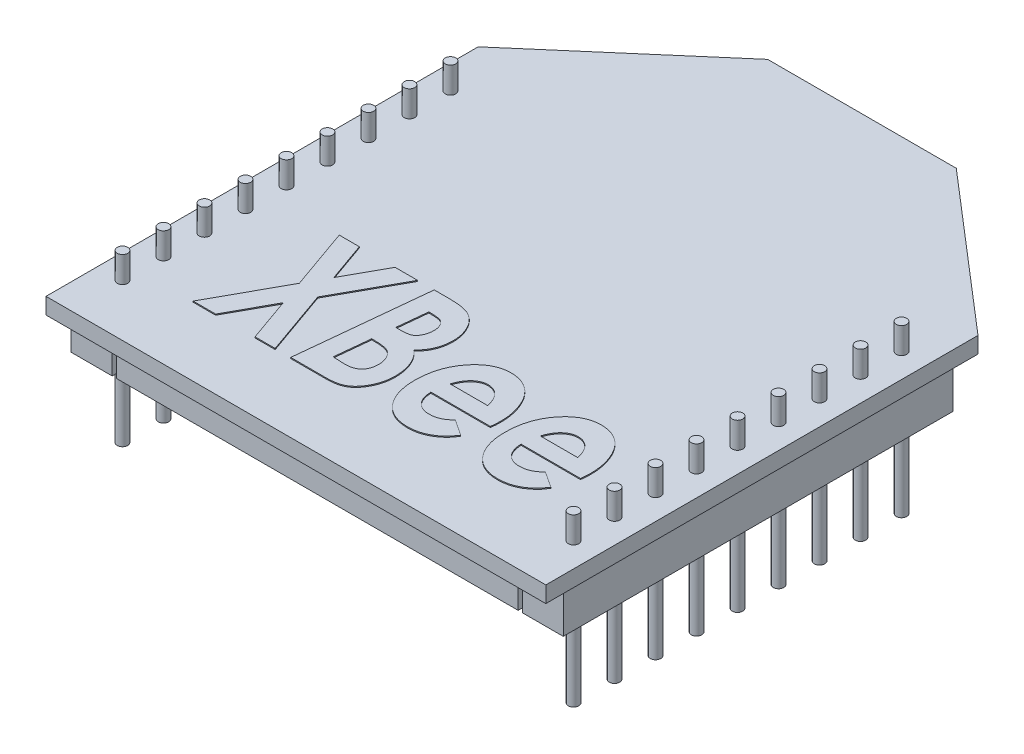
from build123d import *

# Parameters (mm, degrees)
BOSS_EXTRUDE2_DEPTH         = 0.79
SKETCH3_W                   = 2
SKETCH3_H                   = 19
SKETCH3_W_2                 = 19.6
BOSS_EXTRUDE3_DEPTH         = 2
BOSS_EXTRUDE4_DEPTH         = 1.27
BOSS_EXTRUDE4_DEPTH_BACK    = 6.85
SKETCH4_R                   = 0.255
BOSS_EXTRUDE4_2_DEPTH       = 1.27
BOSS_EXTRUDE4_2_DEPTH_BACK  = 6.85
BOSS_EXTRUDE4_3_DEPTH       = 1.27
BOSS_EXTRUDE4_3_DEPTH_BACK  = 6.85
BOSS_EXTRUDE4_4_DEPTH       = 1.27
BOSS_EXTRUDE4_4_DEPTH_BACK  = 6.85
BOSS_EXTRUDE4_5_DEPTH       = 1.27
BOSS_EXTRUDE4_5_DEPTH_BACK  = 6.85
BOSS_EXTRUDE4_6_DEPTH       = 1.27
BOSS_EXTRUDE4_6_DEPTH_BACK  = 6.85
BOSS_EXTRUDE4_7_DEPTH       = 1.27
BOSS_EXTRUDE4_7_DEPTH_BACK  = 6.85
BOSS_EXTRUDE4_8_DEPTH       = 1.27
BOSS_EXTRUDE4_8_DEPTH_BACK  = 6.85
BOSS_EXTRUDE4_9_DEPTH       = 1.27
BOSS_EXTRUDE4_9_DEPTH_BACK  = 6.85
BOSS_EXTRUDE4_10_DEPTH      = 1.27
BOSS_EXTRUDE4_10_DEPTH_BACK = 6.85
BOSS_EXTRUDE4_11_DEPTH      = 1.27
BOSS_EXTRUDE4_11_DEPTH_BACK = 6.85
BOSS_EXTRUDE4_12_DEPTH      = 1.27
BOSS_EXTRUDE4_12_DEPTH_BACK = 6.85
BOSS_EXTRUDE4_13_DEPTH      = 1.27
BOSS_EXTRUDE4_13_DEPTH_BACK = 6.85
BOSS_EXTRUDE4_14_DEPTH      = 1.27
BOSS_EXTRUDE4_14_DEPTH_BACK = 6.85
BOSS_EXTRUDE4_15_DEPTH      = 1.27
BOSS_EXTRUDE4_15_DEPTH_BACK = 6.85
BOSS_EXTRUDE4_16_DEPTH      = 1.27
BOSS_EXTRUDE4_16_DEPTH_BACK = 6.85
BOSS_EXTRUDE4_17_DEPTH      = 1.27
BOSS_EXTRUDE4_17_DEPTH_BACK = 6.85
BOSS_EXTRUDE4_18_DEPTH      = 1.27
BOSS_EXTRUDE4_18_DEPTH_BACK = 6.85
BOSS_EXTRUDE8_DEPTH         = 0.05
BOSS_EXTRUDE8_2_DEPTH       = 0.05
BOSS_EXTRUDE8_3_DEPTH       = 0.05
BOSS_EXTRUDE8_4_DEPTH       = 0.05


with BuildPart() as part:
    # Sketch1 → Boss-Extrude2 (new body)
    with BuildSketch(Plane(origin=(0, 0, 0), x_dir=(1, 0, 0), z_dir=(0, 1, 0))):
        Polygon((0, 0), (0, 21.08), (7.59, 27.61), (16.79, 27.61), (24.38, 21.08), (24.38, 0), align=None)
    extrude(amount=BOSS_EXTRUDE2_DEPTH)

    # Sketch3 → Boss-Extrude3 (add)
    with BuildSketch(Plane.XZ):
        with Locations((23.19, -10.54)):
            Rectangle(SKETCH3_W, SKETCH3_H)
        with Locations((1.19, -10.54)):
            Rectangle(SKETCH3_W, SKETCH3_H)
        with Locations((12.19, -10.54)):
            Rectangle(SKETCH3_W_2, SKETCH3_H)
    extrude(amount=BOSS_EXTRUDE3_DEPTH)


with BuildPart() as body_2:
    # Sketch4 → Boss-Extrude4 (new, two sides: drawn at the far end of the back side and taken through both)
    with BuildSketch(Plane(origin=(0, 0.79, 0), x_dir=(1, 0, 0), z_dir=(0, 1, 0)).offset(-BOSS_EXTRUDE4_DEPTH_BACK)):
        with Locations((1.19, 10.54)):
            Circle(SKETCH4_R)
    extrude(amount=BOSS_EXTRUDE4_DEPTH + BOSS_EXTRUDE4_DEPTH_BACK)


with BuildPart() as body_3:
    # Sketch4 → Boss-Extrude4 2 (new, two sides: drawn at the far end of the back side and taken through both)
    with BuildSketch(Plane(origin=(0, 0.79, 0), x_dir=(1, 0, 0), z_dir=(0, 1, 0)).offset(-BOSS_EXTRUDE4_2_DEPTH_BACK)):
        with Locations((1.19, 12.54)):
            Circle(SKETCH4_R)
    extrude(amount=BOSS_EXTRUDE4_2_DEPTH + BOSS_EXTRUDE4_2_DEPTH_BACK)


with BuildPart() as body_4:
    # Sketch4 → Boss-Extrude4 3 (new, two sides: drawn at the far end of the back side and taken through both)
    with BuildSketch(Plane(origin=(0, 0.79, 0), x_dir=(1, 0, 0), z_dir=(0, 1, 0)).offset(-BOSS_EXTRUDE4_3_DEPTH_BACK)):
        with Locations((1.19, 14.54)):
            Circle(SKETCH4_R)
    extrude(amount=BOSS_EXTRUDE4_3_DEPTH + BOSS_EXTRUDE4_3_DEPTH_BACK)


with BuildPart() as body_5:
    # Sketch4 → Boss-Extrude4 4 (new, two sides: drawn at the far end of the back side and taken through both)
    with BuildSketch(Plane(origin=(0, 0.79, 0), x_dir=(1, 0, 0), z_dir=(0, 1, 0)).offset(-BOSS_EXTRUDE4_4_DEPTH_BACK)):
        with Locations((1.19, 16.54)):
            Circle(SKETCH4_R)
    extrude(amount=BOSS_EXTRUDE4_4_DEPTH + BOSS_EXTRUDE4_4_DEPTH_BACK)


with BuildPart() as body_6:
    # Sketch4 → Boss-Extrude4 5 (new, two sides: drawn at the far end of the back side and taken through both)
    with BuildSketch(Plane(origin=(0, 0.79, 0), x_dir=(1, 0, 0), z_dir=(0, 1, 0)).offset(-BOSS_EXTRUDE4_5_DEPTH_BACK)):
        with Locations((1.19, 18.54)):
            Circle(SKETCH4_R)
    extrude(amount=BOSS_EXTRUDE4_5_DEPTH + BOSS_EXTRUDE4_5_DEPTH_BACK)


with BuildPart() as body_7:
    # Sketch4 → Boss-Extrude4 6 (new, two sides: drawn at the far end of the back side and taken through both)
    with BuildSketch(Plane(origin=(0, 0.79, 0), x_dir=(1, 0, 0), z_dir=(0, 1, 0)).offset(-BOSS_EXTRUDE4_6_DEPTH_BACK)):
        with Locations((1.19, 8.54)):
            Circle(SKETCH4_R)
    extrude(amount=BOSS_EXTRUDE4_6_DEPTH + BOSS_EXTRUDE4_6_DEPTH_BACK)


with BuildPart() as body_8:
    # Sketch4 → Boss-Extrude4 7 (new, two sides: drawn at the far end of the back side and taken through both)
    with BuildSketch(Plane(origin=(0, 0.79, 0), x_dir=(1, 0, 0), z_dir=(0, 1, 0)).offset(-BOSS_EXTRUDE4_7_DEPTH_BACK)):
        with Locations((1.19, 6.54)):
            Circle(SKETCH4_R)
    extrude(amount=BOSS_EXTRUDE4_7_DEPTH + BOSS_EXTRUDE4_7_DEPTH_BACK)


with BuildPart() as body_9:
    # Sketch4 → Boss-Extrude4 8 (new, two sides: drawn at the far end of the back side and taken through both)
    with BuildSketch(Plane(origin=(0, 0.79, 0), x_dir=(1, 0, 0), z_dir=(0, 1, 0)).offset(-BOSS_EXTRUDE4_8_DEPTH_BACK)):
        with Locations((1.19, 4.54)):
            Circle(SKETCH4_R)
    extrude(amount=BOSS_EXTRUDE4_8_DEPTH + BOSS_EXTRUDE4_8_DEPTH_BACK)


with BuildPart() as body_10:
    # Sketch4 → Boss-Extrude4 9 (new, two sides: drawn at the far end of the back side and taken through both)
    with BuildSketch(Plane(origin=(0, 0.79, 0), x_dir=(1, 0, 0), z_dir=(0, 1, 0)).offset(-BOSS_EXTRUDE4_9_DEPTH_BACK)):
        with Locations((1.19, 2.54)):
            Circle(SKETCH4_R)
    extrude(amount=BOSS_EXTRUDE4_9_DEPTH + BOSS_EXTRUDE4_9_DEPTH_BACK)


with BuildPart() as body_11:
    # Sketch4 → Boss-Extrude4 10 (new, two sides: drawn at the far end of the back side and taken through both)
    with BuildSketch(Plane(origin=(0, 0.79, 0), x_dir=(1, 0, 0), z_dir=(0, 1, 0)).offset(-BOSS_EXTRUDE4_10_DEPTH_BACK)):
        with Locations((23.19, 2.54)):
            Circle(SKETCH4_R)
    extrude(amount=BOSS_EXTRUDE4_10_DEPTH + BOSS_EXTRUDE4_10_DEPTH_BACK)


with BuildPart() as body_12:
    # Sketch4 → Boss-Extrude4 11 (new, two sides: drawn at the far end of the back side and taken through both)
    with BuildSketch(Plane(origin=(0, 0.79, 0), x_dir=(1, 0, 0), z_dir=(0, 1, 0)).offset(-BOSS_EXTRUDE4_11_DEPTH_BACK)):
        with Locations((23.19, 4.54)):
            Circle(SKETCH4_R)
    extrude(amount=BOSS_EXTRUDE4_11_DEPTH + BOSS_EXTRUDE4_11_DEPTH_BACK)


with BuildPart() as body_13:
    # Sketch4 → Boss-Extrude4 12 (new, two sides: drawn at the far end of the back side and taken through both)
    with BuildSketch(Plane(origin=(0, 0.79, 0), x_dir=(1, 0, 0), z_dir=(0, 1, 0)).offset(-BOSS_EXTRUDE4_12_DEPTH_BACK)):
        with Locations((23.19, 6.54)):
            Circle(SKETCH4_R)
    extrude(amount=BOSS_EXTRUDE4_12_DEPTH + BOSS_EXTRUDE4_12_DEPTH_BACK)


with BuildPart() as body_14:
    # Sketch4 → Boss-Extrude4 13 (new, two sides: drawn at the far end of the back side and taken through both)
    with BuildSketch(Plane(origin=(0, 0.79, 0), x_dir=(1, 0, 0), z_dir=(0, 1, 0)).offset(-BOSS_EXTRUDE4_13_DEPTH_BACK)):
        with Locations((23.19, 8.54)):
            Circle(SKETCH4_R)
    extrude(amount=BOSS_EXTRUDE4_13_DEPTH + BOSS_EXTRUDE4_13_DEPTH_BACK)


with BuildPart() as body_15:
    # Sketch4 → Boss-Extrude4 14 (new, two sides: drawn at the far end of the back side and taken through both)
    with BuildSketch(Plane(origin=(0, 0.79, 0), x_dir=(1, 0, 0), z_dir=(0, 1, 0)).offset(-BOSS_EXTRUDE4_14_DEPTH_BACK)):
        with Locations((23.19, 18.54)):
            Circle(SKETCH4_R)
    extrude(amount=BOSS_EXTRUDE4_14_DEPTH + BOSS_EXTRUDE4_14_DEPTH_BACK)


with BuildPart() as body_16:
    # Sketch4 → Boss-Extrude4 15 (new, two sides: drawn at the far end of the back side and taken through both)
    with BuildSketch(Plane(origin=(0, 0.79, 0), x_dir=(1, 0, 0), z_dir=(0, 1, 0)).offset(-BOSS_EXTRUDE4_15_DEPTH_BACK)):
        with Locations((23.19, 16.54)):
            Circle(SKETCH4_R)
    extrude(amount=BOSS_EXTRUDE4_15_DEPTH + BOSS_EXTRUDE4_15_DEPTH_BACK)


with BuildPart() as body_17:
    # Sketch4 → Boss-Extrude4 16 (new, two sides: drawn at the far end of the back side and taken through both)
    with BuildSketch(Plane(origin=(0, 0.79, 0), x_dir=(1, 0, 0), z_dir=(0, 1, 0)).offset(-BOSS_EXTRUDE4_16_DEPTH_BACK)):
        with Locations((23.19, 14.54)):
            Circle(SKETCH4_R)
    extrude(amount=BOSS_EXTRUDE4_16_DEPTH + BOSS_EXTRUDE4_16_DEPTH_BACK)


with BuildPart() as body_18:
    # Sketch4 → Boss-Extrude4 17 (new, two sides: drawn at the far end of the back side and taken through both)
    with BuildSketch(Plane(origin=(0, 0.79, 0), x_dir=(1, 0, 0), z_dir=(0, 1, 0)).offset(-BOSS_EXTRUDE4_17_DEPTH_BACK)):
        with Locations((23.19, 12.54)):
            Circle(SKETCH4_R)
    extrude(amount=BOSS_EXTRUDE4_17_DEPTH + BOSS_EXTRUDE4_17_DEPTH_BACK)


with BuildPart() as body_19:
    # Sketch4 → Boss-Extrude4 18 (new, two sides: drawn at the far end of the back side and taken through both)
    with BuildSketch(Plane(origin=(0, 0.79, 0), x_dir=(1, 0, 0), z_dir=(0, 1, 0)).offset(-BOSS_EXTRUDE4_18_DEPTH_BACK)):
        with Locations((23.19, 10.54)):
            Circle(SKETCH4_R)
    extrude(amount=BOSS_EXTRUDE4_18_DEPTH + BOSS_EXTRUDE4_18_DEPTH_BACK)


with BuildPart() as body_20:
    # Sketch6 → Boss-Extrude8 (new body)
    with BuildSketch(Plane(origin=(0, 0.79, 0), x_dir=(1, 0, 0), z_dir=(0, 1, 0))):
        Polygon((4.614192647, 9.688771644), (5.596203865, 9.688771644), (6.276742727, 7.764182301), (7.337620131, 9.688771644), (8.435386557, 9.688771644), (6.705418609, 6.550660667), (7.840074057, 3.338771644), (6.856790804, 3.338771644), (6.106290003, 5.464342558), (4.934745532, 3.338771644), (3.836979105, 3.338771644), (5.677614121, 6.677864192), align=None)
    extrude(amount=BOSS_EXTRUDE8_DEPTH)


with BuildPart() as body_21:
    # Sketch6 → Boss-Extrude8 2 (new body)
    with BuildSketch(Plane(origin=(0, 0.79, 0), x_dir=(1, 0, 0), z_dir=(0, 1, 0))):
        with BuildLine():
            Line((9.246945051, 9.688771644), (10.026702663, 9.688771644))
            add(Edge.make_bspline(
                [(10.026702663, 9.688771644), (10.084388685, 9.688572951), (10.195620935, 9.688189824), (10.356826161, 9.677115119), (10.506205225, 9.662243963), (10.64493952, 9.642702772), (10.771381446, 9.61452289), (10.887158296, 9.581594389), (10.991455616, 9.542984749), (11.11431963, 9.481185503), (11.252800368, 9.386158842), (11.40462435, 9.249659003), (11.533349341, 9.080749432), (11.647128654, 8.891659623), (11.739545212, 8.684553929), (11.80509259, 8.465607089), (11.848213327, 8.239070203), (11.852469363, 8.08493232), (11.854617326, 8.007141035)],
                knots=[0, 0, 0, 0, 0.975894446, 1.881754566, 2.732761623, 3.516110292, 4.250760301, 4.922908887, 5.551891901, 6.129461712, 7.2458477, 8.383428734, 9.569006701, 10.824104868, 12.112097696, 13.394482693, 14.685030986, 16, 16, 16, 16], degree=3))
            add(Edge.make_bspline(
                [(11.854617326, 8.007141035), (11.852927485, 7.941755942), (11.849588213, 7.812549316), (11.822293033, 7.621499152), (11.776053565, 7.436328619), (11.713145566, 7.258009525), (11.633360358, 7.089491725), (11.535960568, 6.934613455), (11.422731756, 6.793186014), (11.334974114, 6.711210173), (11.291105708, 6.670231981)],
                knots=[0, 0, 0, 0, 1.048957551, 2.072831274, 3.089421262, 4.107376656, 5.102609843, 6.074875552, 7.037666253, 8, 8, 8, 8], degree=3))
            add(Edge.make_bspline(
                [(11.291105708, 6.670231981), (11.342815189, 6.620080067), (11.445299303, 6.520682929), (11.576020566, 6.352322158), (11.68777032, 6.173471922), (11.778605116, 5.981717231), (11.850331291, 5.77810271), (11.898766347, 5.561539822), (11.930686786, 5.333847809), (11.934219908, 5.177823932), (11.936027583, 5.097996404)],
                knots=[0, 0, 0, 0, 0.985995519, 1.954165378, 2.911801336, 3.87072296, 4.855588123, 5.863254973, 6.906763013, 8, 8, 8, 8], degree=3))
            add(Edge.make_bspline(
                [(11.936027583, 5.097996404), (11.933758132, 5.014727184), (11.929285332, 4.850614089), (11.888626092, 4.610226449), (11.82264435, 4.38027047), (11.729360645, 4.16558742), (11.621491908, 3.968009924), (11.495445535, 3.797473893), (11.359151608, 3.652657237), (11.232404005, 3.554304916), (11.122497855, 3.49038473), (11.031584211, 3.449855854), (10.932323999, 3.415730623), (10.824186682, 3.388015962), (10.707962165, 3.364677275), (10.582408062, 3.350637319), (10.448798332, 3.339339837), (10.356611716, 3.338964903), (10.30909449, 3.338771644)],
                knots=[0, 0, 0, 0, 1.469776143, 2.8967428, 4.292714978, 5.685167174, 7.022871031, 8.260117555, 9.420157334, 10.52563317, 11.079270911, 11.662509173, 12.280667607, 12.930971386, 13.633033648, 14.372448833, 15.161085193, 16, 16, 16, 16], degree=3))
            Line((10.30909449, 3.338771644), (8.59820707, 3.338771644))
            Line((8.59820707, 3.338771644), (9.246945051, 9.688771644))
        make_face()
        with BuildLine():
            Line((9.893138961, 7.165053696), (10.072495932, 7.165053696))
            add(Edge.make_bspline(
                [(10.072495932, 7.165053696), (10.134007224, 7.165931872), (10.246196132, 7.167533555), (10.398568307, 7.180829329), (10.519235286, 7.202033408), (10.613900952, 7.233655152), (10.687741979, 7.282628622), (10.751375822, 7.344943514), (10.810224021, 7.421983676), (10.861034592, 7.513644018), (10.906147997, 7.61477045), (10.935255731, 7.724819267), (10.955841572, 7.839313599), (10.958001719, 7.917577012), (10.959104506, 7.95753166)],
                knots=[0, 0, 0, 0, 1.60032435, 2.918791578, 3.974691023, 4.784360933, 5.494310405, 6.258984406, 7.09308981, 8.00719273, 8.980683918, 9.965734359, 10.961476823, 12, 12, 12, 12], degree=3))
            add(Edge.make_bspline(
                [(10.959104506, 7.95753166), (10.958396009, 7.994080626), (10.957011043, 8.065526291), (10.938548945, 8.167940887), (10.910603608, 8.263002842), (10.871316269, 8.348903669), (10.823693384, 8.42490546), (10.768640113, 8.489015879), (10.704858788, 8.538382979), (10.64489386, 8.568649381), (10.59011448, 8.587754736), (10.539132038, 8.598204437), (10.47932058, 8.608376682), (10.410200186, 8.617446117), (10.3316563, 8.623512939), (10.243819469, 8.626890288), (10.14671285, 8.629545079), (10.07885817, 8.630130831), (10.043239121, 8.630438311)],
                knots=[0, 0, 0, 0, 1.315058415, 2.570667064, 3.735268981, 4.876803182, 5.961641154, 6.957440426, 7.904605142, 8.847325369, 9.36419389, 9.990463295, 10.718707533, 11.550451555, 12.500567713, 13.555529014, 14.716820544, 16, 16, 16, 16], degree=3))
            Line((10.043239121, 8.630438311), (9.893138961, 7.165053696))
        make_face(mode=Mode.SUBTRACT)
        with BuildLine():
            Line((9.610747134, 4.397104978), (10.197155387, 4.371664273))
            add(Edge.make_bspline(
                [(10.197155387, 4.371664273), (10.232799661, 4.372431828), (10.301694622, 4.373915394), (10.4011725, 4.384267421), (10.493281769, 4.400236547), (10.577891164, 4.424175622), (10.654160403, 4.456467213), (10.724209137, 4.493387866), (10.787016765, 4.537513631), (10.858227275, 4.608451955), (10.932745614, 4.711569925), (10.997234203, 4.855477126), (11.033711595, 5.020312769), (11.038175901, 5.136397883), (11.040514762, 5.197215154)],
                knots=[0, 0, 0, 0, 0.949502302, 1.835243548, 2.66173537, 3.437576639, 4.171842431, 4.864247976, 5.544474933, 6.207507029, 7.533859883, 8.909100507, 10.380670286, 12, 12, 12, 12], degree=3))
            add(Edge.make_bspline(
                [(11.040514762, 5.197215154), (11.039274533, 5.243133905), (11.036855933, 5.33268115), (11.011290995, 5.46293806), (10.972247129, 5.585831981), (10.917436782, 5.699819366), (10.851411849, 5.802612875), (10.772243004, 5.889820968), (10.682707185, 5.96017475), (10.598688719, 6.006166285), (10.522287002, 6.035527723), (10.451856216, 6.0517071), (10.3702962, 6.069346127), (10.276108687, 6.080440498), (10.170687985, 6.092903212), (10.053051975, 6.099632918), (9.923713664, 6.104899258), (9.833360031, 6.106096585), (9.786288, 6.106720362)],
                knots=[0, 0, 0, 0, 1.22801409, 2.394779379, 3.540082136, 4.67248285, 5.771438622, 6.800122652, 7.810794234, 8.806562507, 9.352687556, 9.997013741, 10.738443369, 11.586201183, 12.534023234, 13.580717588, 14.739613093, 16, 16, 16, 16], degree=3))
            Line((9.786288, 6.106720362), (9.610747134, 4.397104978))
        make_face(mode=Mode.SUBTRACT)
    extrude(amount=BOSS_EXTRUDE8_2_DEPTH)


with BuildPart() as body_22:
    # Sketch6 → Boss-Extrude8 3 (new body)
    with BuildSketch(Plane(origin=(0, 0.79, 0), x_dir=(1, 0, 0), z_dir=(0, 1, 0))):
        with BuildLine():
            Line((15.252223496, 4.711297686), (16.029437038, 4.199939513))
            add(Edge.make_bspline(
                [(16.029437038, 4.199939513), (15.98366363, 4.129980492), (15.893111825, 3.991583203), (15.727434596, 3.806749242), (15.540914784, 3.644715089), (15.335041685, 3.505841491), (15.112141127, 3.394277858), (14.874699398, 3.316009372), (14.626006346, 3.265051832), (14.455758151, 3.259948909), (14.369431028, 3.257361388)],
                knots=[0, 0, 0, 0, 1.003574201, 1.985332946, 2.971380164, 3.966340393, 4.962200571, 5.956429806, 6.963774428, 8, 8, 8, 8], degree=3))
            add(Edge.make_bspline(
                [(14.369431028, 3.257361388), (14.302327197, 3.258869409), (14.170898745, 3.261822994), (13.979586202, 3.290860512), (13.798362056, 3.335955214), (13.629058152, 3.401742882), (13.468928679, 3.482697587), (13.322369699, 3.586287415), (13.185397899, 3.70607648), (13.061128027, 3.84407385), (12.949030154, 3.99640738), (12.852809355, 4.162895339), (12.768866046, 4.340169176), (12.703744336, 4.530891432), (12.651427109, 4.732864984), (12.613079081, 4.946664255), (12.591853174, 5.173036902), (12.588849613, 5.327767725), (12.587309634, 5.407100971)],
                knots=[0, 0, 0, 0, 1.02238558, 2.002427451, 2.94315539, 3.86397137, 4.766034858, 5.671635364, 6.592337881, 7.535084861, 8.497051167, 9.470504302, 10.4624557, 11.482631688, 12.537843603, 13.641051432, 14.790525086, 16, 16, 16, 16], degree=3))
            add(Edge.make_bspline(
                [(12.587309634, 5.407100971), (12.588668753, 5.498361554), (12.591337494, 5.677559234), (12.622705984, 5.940044855), (12.666987484, 6.192736446), (12.73367802, 6.433750884), (12.817590795, 6.665338957), (12.922719957, 6.884549787), (13.043090575, 7.095321192), (13.184380013, 7.290126593), (13.335984592, 7.470339421), (13.499303993, 7.627106426), (13.66973003, 7.761281566), (13.84781258, 7.871234428), (14.034500839, 7.95668045), (14.229233376, 8.015786869), (14.431468614, 8.05491275), (14.569380764, 8.058668028), (14.639102503, 8.060566516)],
                knots=[0, 0, 0, 0, 1.177292805, 2.311711504, 3.407723301, 4.485811313, 5.535064, 6.582845514, 7.620111598, 8.663495855, 9.684521823, 10.656062175, 11.580071792, 12.479291213, 13.351198552, 14.221937114, 15.101097073, 16, 16, 16, 16], degree=3))
            add(Edge.make_bspline(
                [(14.639102503, 8.060566516), (14.68109976, 8.059353594), (14.764430211, 8.05694693), (14.887975389, 8.044884503), (15.007567175, 8.021046673), (15.124142641, 7.991345983), (15.236302604, 7.950165938), (15.344601673, 7.899798074), (15.451063528, 7.843280125), (15.55212086, 7.77494595), (15.65065304, 7.700751267), (15.742156098, 7.615969667), (15.828633632, 7.52367761), (15.9122787, 7.425345447), (15.98641377, 7.315661808), (16.05840336, 7.199987462), (16.124316596, 7.075474901), (16.203678194, 6.898062372), (16.289139043, 6.666364486), (16.361761974, 6.374745114), (16.406025598, 6.07162449), (16.411049596, 5.865183633), (16.413591685, 5.760726773)],
                knots=[0, 0, 0, 0, 0.777577212, 1.542859307, 2.293966405, 3.032546248, 3.767405895, 4.501343035, 5.242295665, 5.995409049, 6.756696972, 7.523225489, 8.300446187, 9.097270173, 9.909292085, 10.747844336, 11.618502894, 12.514162514, 14.343938179, 16.180718488, 18.067484516, 20, 20, 20, 20], degree=3))
            add(Edge.make_bspline(
                [(16.413591685, 5.760726773), (16.412830436, 5.725958071), (16.411251635, 5.653849195), (16.407023592, 5.540863865), (16.394302998, 5.419745625), (16.385207515, 5.335860704), (16.380518769, 5.292617798)],
                knots=[0, 0, 0, 0, 0.888845823, 1.843430163, 2.88828236, 4, 4, 4, 4], degree=3))
            Line((16.380518769, 5.292617798), (13.482822455, 5.292617798))
            add(Edge.make_bspline(
                [(13.482822455, 5.292617798), (13.487366798, 5.221505463), (13.496043486, 5.085727945), (13.544190448, 4.893462948), (13.618456726, 4.722878903), (13.706563116, 4.600953028), (13.787661845, 4.516635425), (13.855839895, 4.463965329), (13.927582592, 4.416271348), (14.006726638, 4.380800247), (14.090165959, 4.350265983), (14.179637405, 4.330947567), (14.274034837, 4.317360181), (14.338849503, 4.316258017), (14.371975099, 4.315694721)],
                knots=[0, 0, 0, 0, 1.722637075, 3.289097215, 4.773727274, 6.201335661, 6.905660456, 7.600034957, 8.283620767, 8.986446997, 9.694429871, 10.431739011, 11.198490355, 12, 12, 12, 12], degree=3))
            add(Edge.make_bspline(
                [(14.371975099, 4.315694721), (14.412727495, 4.31706632), (14.493768812, 4.319793919), (14.61357362, 4.3370727), (14.729098391, 4.370124353), (14.841226116, 4.41324305), (14.950791383, 4.468347069), (15.055593001, 4.537265186), (15.157442818, 4.6181359), (15.220119685, 4.679742221), (15.252223496, 4.711297686)],
                knots=[0, 0, 0, 0, 0.985519748, 1.959831208, 2.917440968, 3.884606586, 4.861180757, 5.876329416, 6.912231525, 8, 8, 8, 8], degree=3))
        make_face()
        with BuildLine():
            add(Edge.make_bspline(
                [(15.436668609, 6.106720362), (15.419686641, 6.176329392), (15.387314057, 6.309024509), (15.314832254, 6.49126954), (15.225198233, 6.646823631), (15.119554005, 6.775774626), (14.998707481, 6.876321865), (14.865769439, 6.949994946), (14.719957677, 6.994805856), (14.618211766, 6.99973344), (14.566596493, 7.002233183)],
                knots=[0, 0, 0, 0, 1.263798382, 2.409168385, 3.449078798, 4.421869117, 5.336196411, 6.207213357, 7.090526869, 8, 8, 8, 8], degree=3))
            add(Edge.make_bspline(
                [(14.566596493, 7.002233183), (14.514948627, 6.999787698), (14.411794788, 6.994903446), (14.262528586, 6.947534523), (14.120585477, 6.873482452), (13.98921919, 6.769619972), (13.868696292, 6.63964177), (13.763538511, 6.484643677), (13.673208891, 6.305459961), (13.629158342, 6.174792543), (13.606209875, 6.106720362)],
                knots=[0, 0, 0, 0, 0.877981817, 1.753551551, 2.642409551, 3.594987057, 4.592026125, 5.652341201, 6.776969367, 8, 8, 8, 8], degree=3))
            Line((13.606209875, 6.106720362), (15.436668609, 6.106720362))
        make_face(mode=Mode.SUBTRACT)
    extrude(amount=BOSS_EXTRUDE8_3_DEPTH)


with BuildPart() as body_23:
    # Sketch6 → Boss-Extrude8 4 (new body)
    with BuildSketch(Plane(origin=(0, 0.79, 0), x_dir=(1, 0, 0), z_dir=(0, 1, 0))):
        with BuildLine():
            Line((19.648377343, 4.711297686), (20.425590884, 4.199939513))
            add(Edge.make_bspline(
                [(20.425590884, 4.199939513), (20.379817476, 4.129980492), (20.289265672, 3.991583203), (20.123588442, 3.806749242), (19.93706863, 3.644715089), (19.731195531, 3.505841491), (19.508294974, 3.394277858), (19.270853245, 3.316009372), (19.022160193, 3.265051832), (18.851911997, 3.259948909), (18.765584875, 3.257361388)],
                knots=[0, 0, 0, 0, 1.003574201, 1.985332946, 2.971380164, 3.966340393, 4.962200571, 5.956429806, 6.963774428, 8, 8, 8, 8], degree=3))
            add(Edge.make_bspline(
                [(18.765584875, 3.257361388), (18.698481043, 3.258869409), (18.567052591, 3.261822994), (18.375740048, 3.290860512), (18.194515902, 3.335955214), (18.025211999, 3.401742882), (17.865082525, 3.482697587), (17.718523545, 3.586287415), (17.581551746, 3.70607648), (17.457281873, 3.84407385), (17.345184, 3.99640738), (17.248963201, 4.162895339), (17.165019892, 4.340169176), (17.099898183, 4.530891432), (17.047580955, 4.732864984), (17.009232927, 4.946664255), (16.988007021, 5.173036902), (16.98500346, 5.327767725), (16.98346348, 5.407100971)],
                knots=[0, 0, 0, 0, 1.02238558, 2.002427451, 2.94315539, 3.86397137, 4.766034858, 5.671635364, 6.592337881, 7.535084861, 8.497051167, 9.470504302, 10.4624557, 11.482631688, 12.537843603, 13.641051432, 14.790525086, 16, 16, 16, 16], degree=3))
            add(Edge.make_bspline(
                [(16.98346348, 5.407100971), (16.984822599, 5.498361554), (16.98749134, 5.677559234), (17.018859831, 5.940044855), (17.063141331, 6.192736446), (17.129831867, 6.433750884), (17.213744641, 6.665338957), (17.318873803, 6.884549787), (17.439244421, 7.095321192), (17.58053386, 7.290126593), (17.732138438, 7.470339421), (17.895457839, 7.627106426), (18.065883876, 7.761281566), (18.243966426, 7.871234428), (18.430654685, 7.95668045), (18.625387223, 8.015786869), (18.82762246, 8.05491275), (18.96553461, 8.058668028), (19.035256349, 8.060566516)],
                knots=[0, 0, 0, 0, 1.177292805, 2.311711504, 3.407723301, 4.485811313, 5.535064, 6.582845514, 7.620111598, 8.663495855, 9.684521823, 10.656062175, 11.580071792, 12.479291213, 13.351198552, 14.221937114, 15.101097073, 16, 16, 16, 16], degree=3))
            add(Edge.make_bspline(
                [(19.035256349, 8.060566516), (19.077253606, 8.059353594), (19.160584057, 8.05694693), (19.284129235, 8.044884503), (19.403721021, 8.021046673), (19.520296487, 7.991345983), (19.63245645, 7.950165938), (19.740755519, 7.899798074), (19.847217374, 7.843280125), (19.948274706, 7.77494595), (20.046806886, 7.700751267), (20.138309944, 7.615969667), (20.224787478, 7.52367761), (20.308432546, 7.425345447), (20.382567616, 7.315661808), (20.454557206, 7.199987462), (20.520470442, 7.075474901), (20.599832041, 6.898062372), (20.685292889, 6.666364486), (20.75791582, 6.374745114), (20.802179445, 6.07162449), (20.807203443, 5.865183633), (20.809745532, 5.760726773)],
                knots=[0, 0, 0, 0, 0.777577212, 1.542859307, 2.293966405, 3.032546248, 3.767405895, 4.501343035, 5.242295665, 5.995409049, 6.756696972, 7.523225489, 8.300446187, 9.097270173, 9.909292085, 10.747844336, 11.618502894, 12.514162514, 14.343938179, 16.180718488, 18.067484516, 20, 20, 20, 20], degree=3))
            add(Edge.make_bspline(
                [(20.809745532, 5.760726773), (20.808984282, 5.725958071), (20.807405481, 5.653849195), (20.803177438, 5.540863865), (20.790456844, 5.419745625), (20.781361361, 5.335860704), (20.776672615, 5.292617798)],
                knots=[0, 0, 0, 0, 0.888845823, 1.843430163, 2.88828236, 4, 4, 4, 4], degree=3))
            Line((20.776672615, 5.292617798), (17.878976301, 5.292617798))
            add(Edge.make_bspline(
                [(17.878976301, 5.292617798), (17.883520644, 5.221505463), (17.892197332, 5.085727945), (17.940344294, 4.893462948), (18.014610572, 4.722878903), (18.102716963, 4.600953028), (18.183815691, 4.516635425), (18.251993741, 4.463965329), (18.323736438, 4.416271348), (18.402880484, 4.380800247), (18.486319806, 4.350265983), (18.575791251, 4.330947567), (18.670188684, 4.317360181), (18.735003349, 4.316258017), (18.768128945, 4.315694721)],
                knots=[0, 0, 0, 0, 1.722637075, 3.289097215, 4.773727274, 6.201335661, 6.905660456, 7.600034957, 8.283620767, 8.986446997, 9.694429871, 10.431739011, 11.198490355, 12, 12, 12, 12], degree=3))
            add(Edge.make_bspline(
                [(18.768128945, 4.315694721), (18.808881341, 4.31706632), (18.889922658, 4.319793919), (19.009727466, 4.3370727), (19.125252237, 4.370124353), (19.237379963, 4.41324305), (19.34694523, 4.468347069), (19.451746847, 4.537265186), (19.553596664, 4.6181359), (19.616273531, 4.679742221), (19.648377343, 4.711297686)],
                knots=[0, 0, 0, 0, 0.985519748, 1.959831208, 2.917440968, 3.884606586, 4.861180757, 5.876329416, 6.912231525, 8, 8, 8, 8], degree=3))
        make_face()
        with BuildLine():
            add(Edge.make_bspline(
                [(19.832822455, 6.106720362), (19.815840487, 6.176329392), (19.783467903, 6.309024509), (19.710986101, 6.49126954), (19.621352079, 6.646823631), (19.515707851, 6.775774626), (19.394861327, 6.876321865), (19.261923285, 6.949994946), (19.116111523, 6.994805856), (19.014365612, 6.99973344), (18.962750339, 7.002233183)],
                knots=[0, 0, 0, 0, 1.263798382, 2.409168385, 3.449078798, 4.421869117, 5.336196411, 6.207213357, 7.090526869, 8, 8, 8, 8], degree=3))
            add(Edge.make_bspline(
                [(18.962750339, 7.002233183), (18.911102474, 6.999787698), (18.807948634, 6.994903446), (18.658682432, 6.947534523), (18.516739323, 6.873482452), (18.385373036, 6.769619972), (18.264850138, 6.63964177), (18.159692357, 6.484643677), (18.069362737, 6.305459961), (18.025312188, 6.174792543), (18.002363721, 6.106720362)],
                knots=[0, 0, 0, 0, 0.877981817, 1.753551551, 2.642409551, 3.594987057, 4.592026125, 5.652341201, 6.776969367, 8, 8, 8, 8], degree=3))
            Line((18.002363721, 6.106720362), (19.832822455, 6.106720362))
        make_face(mode=Mode.SUBTRACT)
    extrude(amount=BOSS_EXTRUDE8_4_DEPTH)


solid = Compound([part.part, body_2.part, body_3.part, body_4.part, body_5.part, body_6.part, body_7.part, body_8.part, body_9.part, body_10.part, body_11.part, body_12.part, body_13.part, body_14.part, body_15.part, body_16.part, body_17.part, body_18.part, body_19.part, body_20.part, body_21.part, body_22.part, body_23.part])
